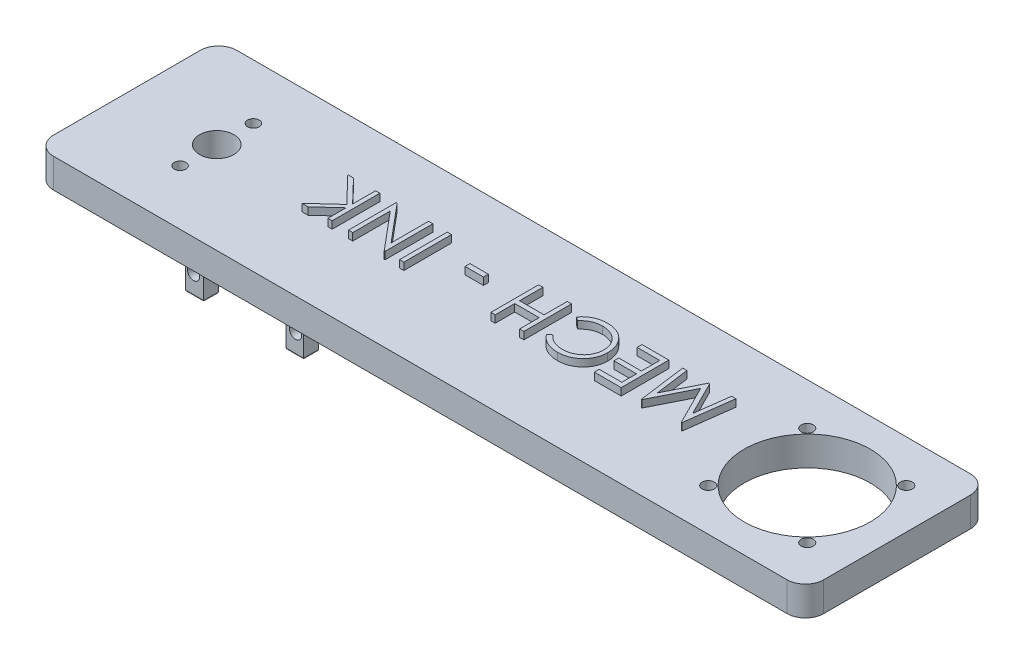
from build123d import *

# Parameters (mm, degrees)
CROQUIS1_W              = 210
CROQUIS1_H              = 50
CROQUIS1_R              = 4.7
CROQUIS1_R_2            = 17.2
CROQUIS1_R_3            = 1.65
CROQUIS1_R_4            = 1.6
SALIENTE_EXTRUIR1_DEPTH = 8
CROQUIS1_3_W            = 210
CROQUIS1_3_H            = 50
CROQUIS1_3_R            = 4.7
CROQUIS1_3_R_2          = 17.2
CROQUIS1_3_R_3          = 1.65
CROQUIS1_3_R_4          = 1.6
SALIENTE_EXTRUIR2_DEPTH = 8
CROQUIS1_4_W            = 210
CROQUIS1_4_H            = 50
CROQUIS1_4_R            = 1.6
CROQUIS1_4_R_2          = 4.7
CROQUIS1_4_R_3          = 1.65
CROQUIS1_4_R_4          = 17.2
SALIENTE_EXTRUIR3_DEPTH = 6
CROQUIS2_W              = 1.166666667
CROQUIS2_H              = 13
CROQUIS2_W_2            = 5
CROQUIS2_H_2            = 1.333333333
SALIENTE_EXTRUIR4_DEPTH = 2
CROQUIS3_W              = 4.963333066
CROQUIS3_H              = 4
CROQUIS3_W_2            = 4.756666934
SALIENTE_EXTRUIR6_DEPTH = 14
REDONDEO1_R             = 1.5
REDONDEO2_R             = 3
CROQUIS4_R              = 1.65
CORTAR_EXTRUIR1_DEPTH   = 14
REDONDEO3_R             = 0.5
REDONDEO4_R             = 5


with BuildPart() as part:
    # Croquis1 → Saliente-Extruir1 (new body)
    with BuildSketch(Plane(origin=(0, 0, 0), x_dir=(1, 0, 0), z_dir=(0, 1, 0))):
        Rectangle(CROQUIS1_W, CROQUIS1_H)
        with Locations((-80.5, 0)):
            Circle(CROQUIS1_R, mode=Mode.SUBTRACT)
        with Locations((80.5, 0)):
            Circle(CROQUIS1_R_2, mode=Mode.SUBTRACT)
        with Locations((67, 13.5)):
            Circle(CROQUIS1_R_3, mode=Mode.SUBTRACT)
        with Locations((94, 13.5)):
            Circle(CROQUIS1_R_3, mode=Mode.SUBTRACT)
        with Locations((94, -13.5)):
            Circle(CROQUIS1_R_3, mode=Mode.SUBTRACT)
        with Locations((67, -13.5)):
            Circle(CROQUIS1_R_3, mode=Mode.SUBTRACT)
        with Locations((-80.5, 10)):
            Circle(CROQUIS1_R_4, mode=Mode.SUBTRACT)
        with Locations((-80.5, -10)):
            Circle(CROQUIS1_R_4, mode=Mode.SUBTRACT)
    extrude(amount=SALIENTE_EXTRUIR1_DEPTH)

    # Croquis1<3> → Saliente-Extruir2 (add)
    with BuildSketch(Plane(origin=(0, 0, 0), x_dir=(1, 0, 0), z_dir=(0, 1, 0))):
        Rectangle(CROQUIS1_3_W, CROQUIS1_3_H)
        with Locations((-80.5, 0)):
            Circle(CROQUIS1_3_R, mode=Mode.SUBTRACT)
        with Locations((80.5, 0)):
            Circle(CROQUIS1_3_R_2, mode=Mode.SUBTRACT)
        with Locations((67, 13.5)):
            Circle(CROQUIS1_3_R_3, mode=Mode.SUBTRACT)
        with Locations((94, 13.5)):
            Circle(CROQUIS1_3_R_3, mode=Mode.SUBTRACT)
        with Locations((94, -13.5)):
            Circle(CROQUIS1_3_R_3, mode=Mode.SUBTRACT)
        with Locations((67, -13.5)):
            Circle(CROQUIS1_3_R_3, mode=Mode.SUBTRACT)
        with Locations((-80.5, 10)):
            Circle(CROQUIS1_3_R_4, mode=Mode.SUBTRACT)
        with Locations((-80.5, -10)):
            Circle(CROQUIS1_3_R_4, mode=Mode.SUBTRACT)
    extrude(amount=SALIENTE_EXTRUIR2_DEPTH)

    # Croquis1<4> → Saliente-Extruir3 (add)
    with BuildSketch(Plane(origin=(0, 0, 0), x_dir=(1, 0, 0), z_dir=(0, 1, 0))):
        Rectangle(CROQUIS1_4_W, CROQUIS1_4_H)
        with Locations((-80.5, -10)):
            Circle(CROQUIS1_4_R, mode=Mode.SUBTRACT)
        with Locations((-80.5, 0)):
            Circle(CROQUIS1_4_R_2, mode=Mode.SUBTRACT)
        with Locations((67, -13.5)):
            Circle(CROQUIS1_4_R_3, mode=Mode.SUBTRACT)
        with Locations((94, -13.5)):
            Circle(CROQUIS1_4_R_3, mode=Mode.SUBTRACT)
        with Locations((80.5, 0)):
            Circle(CROQUIS1_4_R_4, mode=Mode.SUBTRACT)
        with Locations((-80.5, 10)):
            Circle(CROQUIS1_4_R, mode=Mode.SUBTRACT)
        with Locations((67, 13.5)):
            Circle(CROQUIS1_4_R_3, mode=Mode.SUBTRACT)
        with Locations((94, 13.5)):
            Circle(CROQUIS1_4_R_3, mode=Mode.SUBTRACT)
    extrude(amount=SALIENTE_EXTRUIR3_DEPTH)

    # Croquis2 → Saliente-Extruir4 (add)
    with BuildSketch(Plane(origin=(0, 8, 0), x_dir=(1, 0, 0), z_dir=(0, 1, 0))):
        Polygon((-44.783333333, -4.240706589), (-45.95, -4.240706589), (-45.95, 0.709814244), (-51.369270833, -4.240706589), (-53.033333333, -4.240706589), (-46.6453125, 1.592626744), (-53.533333333, 8.759293411), (-51.976041667, 8.759293411), (-45.95, 2.485855911), (-45.95, 8.759293411), (-44.783333333, 8.759293411), align=None)
        Polygon((-30.35, 8.759293411), (-30.35, -4.240706589), (-30.594791667, -4.240706589), (-39.183333333, 5.991064244), (-39.183333333, -4.240706589), (-40.35, -4.240706589), (-40.35, 8.759293411), (-40.084375, 8.759293411), (-31.516666667, -1.449039923), (-31.516666667, 8.759293411), align=None)
        with Locations((-25.833333334, 2.259293411)):
            Rectangle(CROQUIS2_W, CROQUIS2_H)
        with Locations((-13.383333333, 3.759293411)):
            Rectangle(CROQUIS2_W_2, CROQUIS2_H_2)
        Polygon((7.483333333, -4.240706589), (6.316666667, -4.240706589), (6.316666667, 1.092626744), (-0.35, 1.092626744), (-0.35, -4.240706589), (-1.516666667, -4.240706589), (-1.516666667, 8.759293411), (-0.35, 8.759293411), (-0.35, 2.425960077), (6.316666667, 2.425960077), (6.316666667, 8.759293411), (7.483333333, 8.759293411), align=None)
        with BuildLine():
            Line((11.25, -1.855289923), (12.270833333, -1.074039923))
            add(Edge.make_bspline(
                [(12.270833333, -1.074039923), (12.343655951, -1.160826662), (12.48831938, -1.333230069), (12.721042589, -1.575342389), (12.96363259, -1.802093114), (13.21575185, -2.014939148), (13.483234992, -2.205325769), (13.755890155, -2.388080445), (14.043624109, -2.548088452), (14.439484744, -2.74355825), (14.959357186, -2.94308352), (15.611529457, -3.114692476), (16.293271069, -3.222905137), (16.758272949, -3.234704803), (16.994791667, -3.240706589)],
                knots=[0, 0, 0, 0, 0.75789156, 1.505565099, 2.245254514, 2.979266606, 3.711207489, 4.440978832, 5.174393176, 5.91211879, 7.394186119, 8.890401545, 10.418332761, 12, 12, 12, 12], degree=3))
            add(Edge.make_bspline(
                [(16.994791667, -3.240706589), (17.12509948, -3.239199387), (17.384505728, -3.23619897), (17.769509148, -3.196893563), (18.148052557, -3.141013114), (18.518728283, -3.060114561), (18.88080034, -2.954791988), (19.23702558, -2.831276708), (19.583208719, -2.677574537), (19.923515616, -2.50783079), (20.249538473, -2.316052367), (20.558073628, -2.106934839), (20.847729553, -1.882544034), (21.119242894, -1.643410216), (21.369877739, -1.38674167), (21.602296689, -1.115422214), (21.816203091, -0.828226555), (22.011376242, -0.526526929), (22.185946317, -0.211813638), (22.337326934, 0.114561484), (22.465287991, 0.451351599), (22.569098078, 0.797834922), (22.650344094, 1.15278499), (22.706583639, 1.517472715), (22.745526925, 1.891260642), (22.748500903, 2.144608743), (22.75, 2.272314244)],
                knots=[0, 0, 0, 0, 1.054960097, 2.100129169, 3.131228542, 4.15308236, 5.169990287, 6.183953224, 7.204064171, 8.235355279, 9.262684623, 10.264978336, 11.252191258, 12.228402777, 13.192898315, 14.155264692, 15.119862721, 16.091023151, 17.063429752, 18.032246104, 19.00241354, 19.978852882, 20.959535218, 21.948948728, 22.966123959, 24, 24, 24, 24], degree=3))
            add(Edge.make_bspline(
                [(22.75, 2.272314244), (22.745302254, 2.464454863), (22.736078853, 2.841697483), (22.654341045, 3.394334841), (22.529134737, 3.924270028), (22.34455687, 4.427914903), (22.112420917, 4.909467955), (21.822779255, 5.363089368), (21.486053832, 5.795424829), (21.098790278, 6.196003423), (20.673843153, 6.561906372), (20.217925317, 6.884124189), (19.732154317, 7.152721961), (19.221898474, 7.376232717), (18.683229993, 7.548043393), (18.117117885, 7.668995859), (17.524793327, 7.747895385), (17.120049843, 7.755449084), (16.9140625, 7.759293411)],
                knots=[0, 0, 0, 0, 1.029159485, 2.020618137, 2.987588728, 3.942669054, 4.889339625, 5.846988364, 6.821327795, 7.821533711, 8.827683044, 9.822769455, 10.807800696, 11.797391277, 12.803701919, 13.832062008, 14.896664671, 16, 16, 16, 16], degree=3))
            add(Edge.make_bspline(
                [(16.9140625, 7.759293411), (16.687109655, 7.7530208), (16.240412165, 7.740674802), (15.585330924, 7.636083305), (14.958226652, 7.466496753), (14.359065616, 7.229161613), (13.78953693, 6.920633401), (13.248749335, 6.546612714), (12.736246359, 6.103541763), (12.42806731, 5.765233001), (12.270833333, 5.592626744)],
                knots=[0, 0, 0, 0, 1.028121516, 2.023589091, 2.998037872, 3.967518031, 4.937445131, 5.927275754, 6.942489185, 8, 8, 8, 8], degree=3))
            Line((12.270833333, 5.592626744), (11.25, 6.366064244))
            add(Edge.make_bspline(
                [(11.25, 6.366064244), (11.332155751, 6.472060721), (11.496073732, 6.683545958), (11.761448116, 6.981749745), (12.04120307, 7.262000088), (12.33609381, 7.522837459), (12.646505293, 7.765565618), (12.972301851, 7.989055924), (13.311858523, 8.195787555), (13.665600488, 8.383165493), (14.033547109, 8.549900558), (14.412545163, 8.695626625), (14.803288905, 8.817991758), (15.202697002, 8.920803803), (15.614873364, 8.994231241), (16.035101977, 9.052668244), (16.467295429, 9.087345125), (16.758619208, 9.090850411), (16.90625, 9.092626744)],
                knots=[0, 0, 0, 0, 0.986880684, 1.969034265, 2.935876267, 3.899990983, 4.864973347, 5.834408638, 6.8063673, 7.789580233, 8.778939794, 9.778051223, 10.776304221, 11.791326552, 12.811423977, 13.855999788, 14.91350973, 16, 16, 16, 16], degree=3))
            add(Edge.make_bspline(
                [(16.90625, 9.092626744), (17.046069335, 9.091653629), (17.322544755, 9.089729414), (17.730740118, 9.058558506), (18.12812999, 9.016030912), (18.5135786, 8.95199614), (18.889189365, 8.876431448), (19.25155725, 8.775138209), (19.604248031, 8.661669876), (19.945844725, 8.528308497), (20.276637896, 8.377819819), (20.595560624, 8.207736886), (20.90246623, 8.01948996), (21.200372079, 7.817228493), (21.48487739, 7.594455657), (21.758447627, 7.3542653), (22.022616824, 7.097466975), (22.186055368, 6.912291805), (22.268229167, 6.819189244)],
                knots=[0, 0, 0, 0, 1.114604814, 2.203992996, 3.262667896, 4.300477797, 5.318619304, 6.316056647, 7.298880507, 8.271930387, 9.238335007, 10.195173496, 11.151986948, 12.108099108, 13.064862484, 14.031167946, 15.010108607, 16, 16, 16, 16], degree=3))
            add(Edge.make_bspline(
                [(22.268229167, 6.819189244), (22.399838686, 6.657461492), (22.66146882, 6.335958506), (22.996347756, 5.814945413), (23.282046576, 5.271447992), (23.515623212, 4.702318214), (23.695037319, 4.10733483), (23.821177099, 3.487454995), (23.902574906, 2.843917881), (23.911917679, 2.406244549), (23.916666667, 2.183772577)],
                knots=[0, 0, 0, 0, 0.994611881, 1.977215934, 2.950189954, 3.921972279, 4.908960509, 5.911694611, 6.938501887, 8, 8, 8, 8], degree=3))
            add(Edge.make_bspline(
                [(23.916666667, 2.183772577), (23.910864397, 1.949947819), (23.899448794, 1.489912204), (23.803261737, 0.814612174), (23.646650626, 0.168557981), (23.430996083, -0.450736239), (23.146490082, -1.039727118), (22.802072558, -1.600902215), (22.394379386, -2.133803312), (21.928530801, -2.631617221), (21.417539494, -3.086751262), (20.870362366, -3.487177475), (20.288027564, -3.820413127), (19.676961756, -4.098970526), (19.032586232, -4.313078471), (18.356276613, -4.462961752), (17.64930349, -4.556253894), (17.166957339, -4.568047524), (16.921875, -4.574039923)],
                knots=[0, 0, 0, 0, 1.032901378, 2.032168977, 3.007206631, 3.966850309, 4.924221947, 5.891988639, 6.871730993, 7.884084801, 8.900290346, 9.89161143, 10.874607481, 11.860025555, 12.854717796, 13.869097222, 14.917278314, 16, 16, 16, 16], degree=3))
            add(Edge.make_bspline(
                [(16.921875, -4.574039923), (16.772507159, -4.572248904), (16.47684856, -4.568703762), (16.039478702, -4.534141279), (15.613674872, -4.476507593), (15.198252539, -4.397962454), (14.792526491, -4.300267397), (14.398320091, -4.17794028), (14.016762851, -4.030038711), (13.645281922, -3.865427926), (13.288640313, -3.676904135), (12.947015427, -3.471987254), (12.623181191, -3.246731273), (12.315032528, -3.004421477), (12.023994102, -2.743193808), (11.745698026, -2.467439165), (11.488407521, -2.169842618), (11.329614646, -1.960332757), (11.25, -1.855289923)],
                knots=[0, 0, 0, 0, 1.096566765, 2.170543479, 3.218870886, 4.250164525, 5.273529809, 6.281496242, 7.278154839, 8.276706968, 9.263143576, 10.238168486, 11.199979644, 12.157579042, 13.114563119, 14.070017788, 15.032356758, 16, 16, 16, 16], degree=3))
        make_face()
        Polygon((34.016666667, -4.240706589), (26.683333333, -4.240706589), (26.683333333, -2.907373256), (32.85, -2.907373256), (32.85, 1.092626744), (26.683333333, 1.092626744), (26.683333333, 2.425960077), (32.85, 2.425960077), (32.85, 7.425960077), (26.683333333, 7.425960077), (26.683333333, 8.759293411), (34.016666667, 8.759293411), align=None)
        Polygon((52.283333333, 8.759293411), (50.5671875, -4.240706589), (50.400520833, -4.240706589), (45.033333333, 6.425960077), (39.681770833, -4.240706589), (39.515104167, -4.240706589), (37.783333333, 8.759293411), (38.95, 8.759293411), (40.2, -0.587060756), (44.890104167, 8.759293411), (45.155729167, 8.759293411), (49.866666667, -0.615706589), (51.108854167, 8.759293411), align=None)
    extrude(amount=SALIENTE_EXTRUIR4_DEPTH)

    # Croquis3 → Saliente-Extruir6 (add)
    with BuildSketch(Plane.XZ):
        with Locations((-69.538333467, 15)):
            Rectangle(CROQUIS3_W, CROQUIS3_H)
        with Locations((-42.178333467, 15)):
            Rectangle(CROQUIS3_W_2, CROQUIS3_H)
        with Locations((-42.178333467, 7.8)):
            Rectangle(CROQUIS3_W_2, CROQUIS3_H)
        with Locations((-69.538333467, 7.8)):
            Rectangle(CROQUIS3_W, CROQUIS3_H)
    extrude(amount=SALIENTE_EXTRUIR6_DEPTH)

    # Redondeo1
    redondeo1_edges = [part.edges().sort_by_distance(p)[0] for p in [
        (-42.178333467, 0, 17),
        (-39.8, 0, 15),
        (-42.178333467, 0, 13),
        (-69.538333467, 0, 17),
        (-69.538333467, 0, 13),
        (-72.02, 0, 15),
        (-42.178333467, 0, 9.8),
        (-39.8, 0, 7.8),
        (-42.178333467, 0, 5.8),
        (-69.538333467, 0, 5.8),
        (-72.02, 0, 7.8),
        (-69.538333467, 0, 9.8),
    ]]
    fillet(redondeo1_edges, radius=REDONDEO1_R)

    # Redondeo2
    redondeo2_edges = [part.edges().sort_by_distance(p)[0] for p in [
        (-44.556666934, 0, 15),
        (-67.056666934, 0, 15),
        (-44.556666934, 0, 7.8),
        (-67.056666934, 0, 7.8),
    ]]
    fillet(redondeo2_edges, radius=REDONDEO2_R)

    # Croquis4 → Cortar-Extruir1 (cut)
    with BuildSketch(Plane.XY.offset(17)):
        with Locations((-42.023832868, -8.6)):
            Circle(CROQUIS4_R)
        with Locations((-69.823832868, -8.6)):
            Circle(CROQUIS4_R)
    extrude(amount=-CORTAR_EXTRUIR1_DEPTH, mode=Mode.SUBTRACT)

    # Redondeo3
    redondeo3_edges = [part.edges().sort_by_distance(p)[0] for p in [
        (-69.538333467, -14, 17),
        (-67.056666934, -14, 15),
        (-69.538333467, -14, 13),
        (-72.02, -14, 15),
        (-72.02, -14, 7.8),
        (-69.538333467, -14, 9.8),
        (-67.056666934, -14, 7.8),
        (-69.538333467, -14, 5.8),
        (-39.8, -14, 15),
        (-42.178333467, -14, 13),
        (-44.556666934, -14, 15),
        (-42.178333467, -14, 17),
        (-42.178333467, -14, 9.8),
        (-39.8, -14, 7.8),
        (-42.178333467, -14, 5.8),
        (-44.556666934, -14, 7.8),
    ]]
    fillet(redondeo3_edges, radius=REDONDEO3_R)

    # Redondeo4
    redondeo4_edges = [part.edges().sort_by_distance(p)[0] for p in [
        (105, 4, -25),
        (105, 4, 25),
        (-105, 4, 25),
        (-105, 4, -25),
    ]]
    fillet(redondeo4_edges, radius=REDONDEO4_R)


solid = part.part
